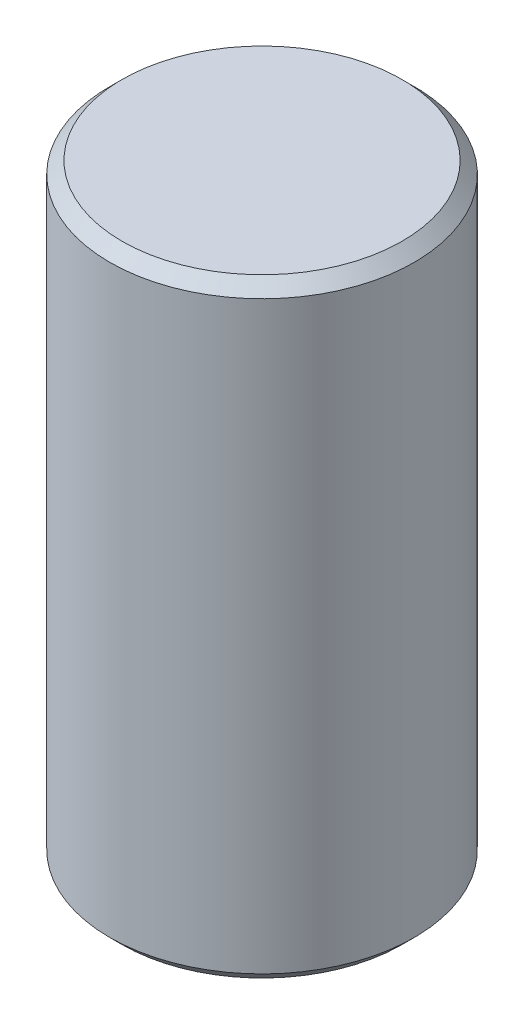
from build123d import *

# Parameters (mm, degrees)
SKETCH1_R           = 1.25
BOSS_EXTRUDE1_DEPTH = 5
CHAMFER1_SIZE       = 0.1


with BuildPart() as part:
    # Sketch1 → Boss-Extrude1 (new body)
    with BuildSketch(Plane(origin=(0, 0, 0), x_dir=(1, 0, 0), z_dir=(0, 1, 0))):
        Circle(SKETCH1_R)
    extrude(amount=BOSS_EXTRUDE1_DEPTH)

    # Chamfer1
    chamfer1_edges = [part.edges().sort_by_distance(p)[0] for p in [
        (-1.25, 0, 0),
        (-1.25, 5, 0),
    ]]
    chamfer(chamfer1_edges, length=CHAMFER1_SIZE)


solid = part.part
